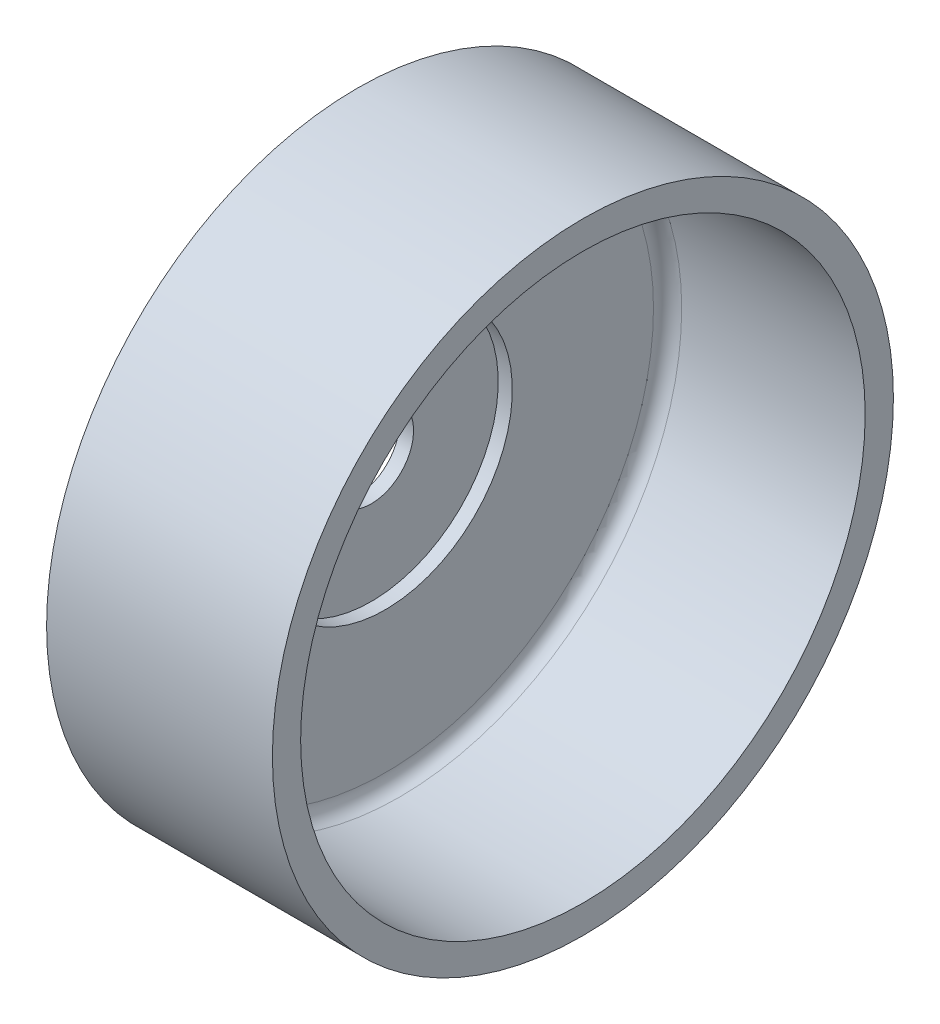
from build123d import *


with BuildPart() as part:
    # Sketch1 → Revolve1 (revolve)
    with BuildSketch(Plane(origin=(0, 0, 0), x_dir=(1, 0, 0), z_dir=(0, 1, 0))):
        with BuildLine():
            Line((0, 4.7625), (0, 34.925))
            Line((0, 34.925), (25.4, 34.925))
            Line((25.4, 34.925), (25.4, 31.75))
            Line((25.4, 31.75), (4.7625, 31.75))
            ThreePointArc((4.7625, 31.75), (3.639967985, 31.285032015), (3.175, 30.1625))
            Line((3.175, 30.1625), (3.175, 14.2875))
            Line((3.175, 14.2875), (1.5875, 14.2875))
            Line((1.5875, 14.2875), (1.5875, 4.7625))
            Line((1.5875, 4.7625), (0, 4.7625))
        make_face()
    revolve(axis=Axis((1.5875, 0, 0), (1, 0, 0)))


solid = part.part
